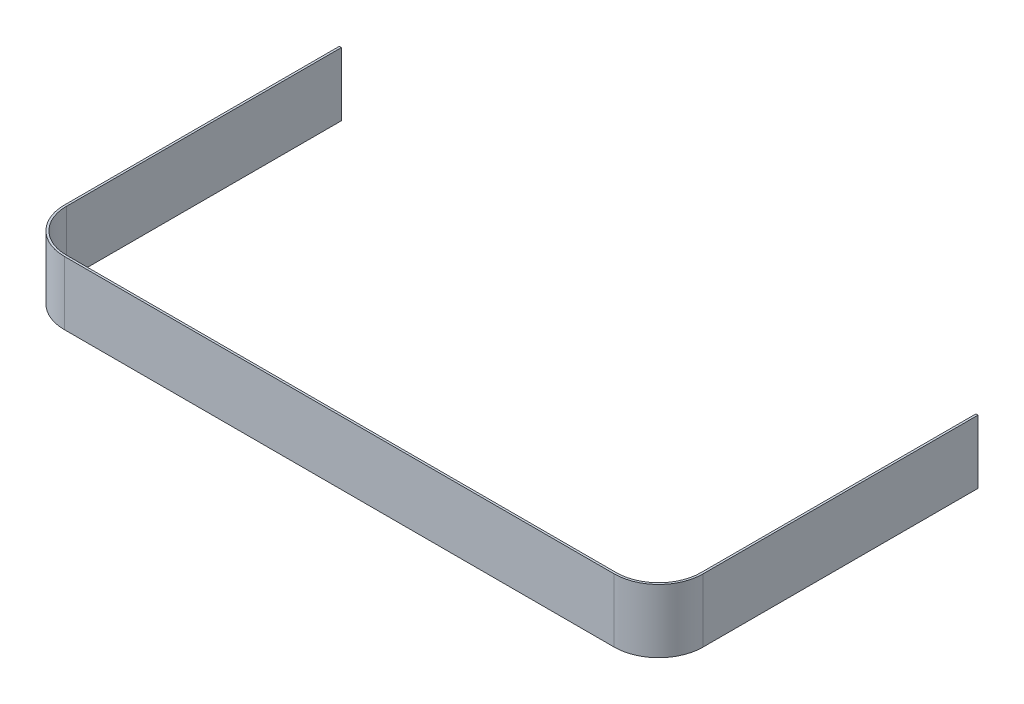
from build123d import *

# Parameters (mm, degrees)
LINEAR_AUSTRAGEN_D_NN1_DEPTH = 30


with BuildPart() as part:
    # Skizze1 → Linear-Austragen-Dünn1 (new body)
    with BuildSketch(Plane.XZ):
        with BuildLine():
            Line((0, 75), (130, 75))
            ThreePointArc((130, 75), (144.142135624, 69.142135624), (150, 55))
            Line((150, 55), (150, -75))
            Line((150, -75), (151, -75))
            Line((151, -75), (151, 55))
            ThreePointArc((151, 55), (144.849242405, 69.849242405), (130, 76))
            Line((130, 76), (0, 76))
            Line((0, 76), (0, 75))
        make_face()
    linear_austragen_d_nn1 = extrude(amount=-LINEAR_AUSTRAGEN_D_NN1_DEPTH)

    # Spiegeln1: Linear-Austragen-Dünn1 across plane
    add(linear_austragen_d_nn1.mirror(Plane(origin=(0, 30, 75), x_dir=(0, 0, 1), z_dir=(1, 0, 0))))


solid = part.part
